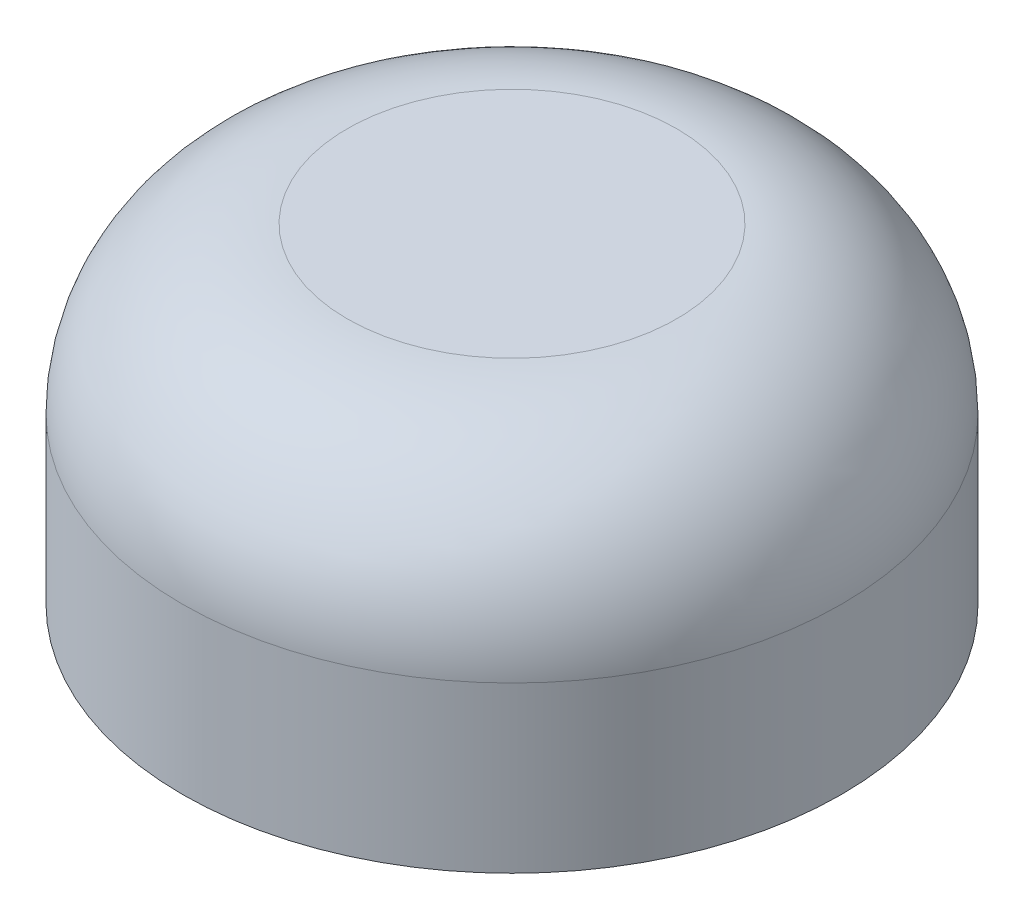
from build123d import *

# Parameters (mm, degrees)
SKETCH1_R           = 6.35
BOSS_EXTRUDE1_DEPTH = 6.35
SKETCH2_R           = 3.175
CUT_EXTRUDE1_DEPTH  = 3.556
FILLET1_R           = 3.175


with BuildPart() as part:
    # Sketch1 → Boss-Extrude1 (new body)
    with BuildSketch(Plane(origin=(0, 0, 0), x_dir=(1, 0, 0), z_dir=(0, 1, 0))):
        Circle(SKETCH1_R)
    extrude(amount=BOSS_EXTRUDE1_DEPTH)

    # Sketch2 → Cut-Extrude1 (cut)
    with BuildSketch(Plane.XZ):
        Circle(SKETCH2_R)
    extrude(amount=-CUT_EXTRUDE1_DEPTH, mode=Mode.SUBTRACT)

    # Fillet1
    fillet1_edges = [part.edges().sort_by_distance(p)[0] for p in [
        (-6.35, 6.35, 0),
    ]]
    fillet(fillet1_edges, radius=FILLET1_R)


solid = part.part
